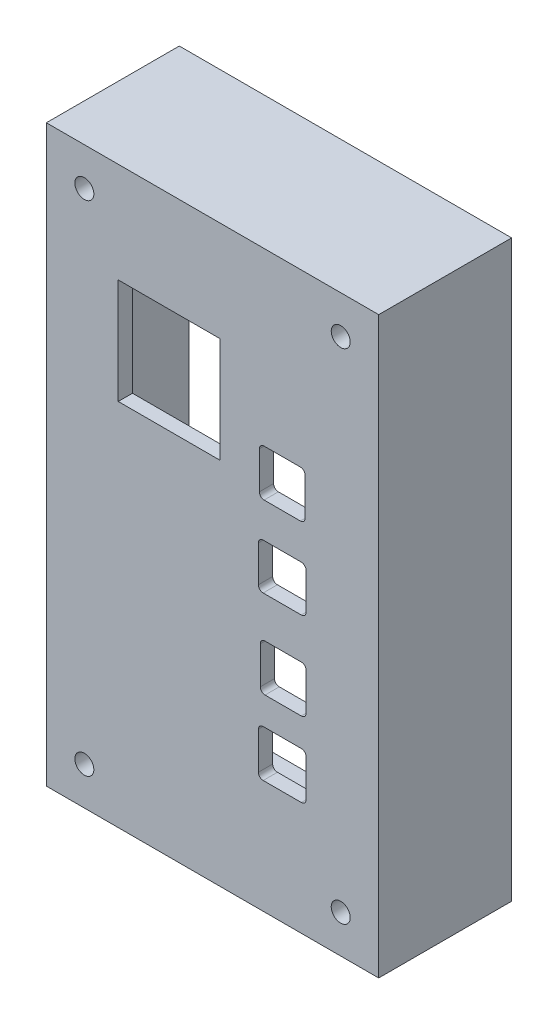
from build123d import *

# Parameters (mm, degrees)
SALIENTE_EXTRUIR1_OUTLINE_W   = 70
SALIENTE_EXTRUIR1_OUTLINE_H   = 121
SALIENTE_EXTRUIR1_OUTLINE_W_2 = 21.402751614
SALIENTE_EXTRUIR1_OUTLINE_H_2 = 22.176249264
SALIENTE_EXTRUIR1_DEPTH       = 3
CROQUIS3_W                    = 70
CROQUIS3_H                    = 121
CROQUIS3_W_2                  = 66
CROQUIS3_H_2                  = 117
SALIENTE_EXTRUIR2_DEPTH       = 25
CROQUIS6_R                    = 2
CORTAR_EXTRUIR1_DEPTH         = 10


# Read off the part's stored shape, not the designer's step: Saliente-Extruir1
with BuildPart() as part:
    # Saliente-Extruir1 outline → Saliente-Extruir1 (new body)
    with BuildSketch(Plane.XY):
        Rectangle(SALIENTE_EXTRUIR1_OUTLINE_W, SALIENTE_EXTRUIR1_OUTLINE_H)
        with BuildLine():
            Line((10.665295135, -26.794102385), (18.701771575, -26.794102385))
            ThreePointArc((18.701771575, -26.794102385), (19.408878356, -27.086995604), (19.701771575, -27.794102385))
            Line((19.701771575, -27.794102385), (19.701771575, -35.634526795))
            ThreePointArc((19.701771575, -35.634526795), (19.408878356, -36.341633576), (18.701771575, -36.634526795))
            Line((18.701771575, -36.634526795), (10.665295135, -36.634526795))
            ThreePointArc((10.665295135, -36.634526795), (9.958188354, -36.341633576), (9.665295135, -35.634526795))
            Line((9.665295135, -35.634526795), (9.665295135, -27.794102385))
            ThreePointArc((9.665295135, -27.794102385), (9.958188354, -27.086995604), (10.665295135, -26.794102385))
        make_face(mode=Mode.SUBTRACT)
        with BuildLine():
            Line((10.057242416, -19.858648736), (10.057242416, -12.018224326))
            ThreePointArc((10.057242416, -12.018224326), (10.350135635, -11.311117545), (11.057242416, -11.018224326))
            Line((11.057242416, -11.018224326), (18.701771575, -11.018224326))
            ThreePointArc((18.701771575, -11.018224326), (19.408878356, -11.311117545), (19.701771575, -12.018224326))
            Line((19.701771575, -12.018224326), (19.701771575, -19.858648736))
            ThreePointArc((19.701771575, -19.858648736), (19.408878356, -20.565755517), (18.701771575, -20.858648736))
            Line((18.701771575, -20.858648736), (11.057242416, -20.858648736))
            ThreePointArc((11.057242416, -20.858648736), (10.350135635, -20.565755517), (10.057242416, -19.858648736))
        make_face(mode=Mode.SUBTRACT)
        with Locations((-9.158031826, 28.317647119)):
            Rectangle(SALIENTE_EXTRUIR1_OUTLINE_W_2, SALIENTE_EXTRUIR1_OUTLINE_H_2, mode=Mode.SUBTRACT)
        with BuildLine():
            Line((9.665295135, -1.437126531), (9.665295135, 6.207324239))
            ThreePointArc((9.665295135, 6.207324239), (9.958188354, 6.91443102), (10.665295135, 7.207324239))
            Line((10.665295135, 7.207324239), (18.701771575, 7.207324239))
            ThreePointArc((18.701771575, 7.207324239), (19.408878356, 6.91443102), (19.701771575, 6.207324239))
            Line((19.701771575, 6.207324239), (19.701771575, -1.437126531))
            ThreePointArc((19.701771575, -1.437126531), (19.408878356, -2.144233312), (18.701771575, -2.437126531))
            Line((18.701771575, -2.437126531), (10.665295135, -2.437126531))
            ThreePointArc((10.665295135, -2.437126531), (9.958188354, -2.144233312), (9.665295135, -1.437126531))
        make_face(mode=Mode.SUBTRACT)
        with BuildLine():
            Line((9.861268776, 15.612580192), (9.861268776, 23.453004601))
            ThreePointArc((9.861268776, 23.453004601), (10.154161995, 24.160111382), (10.861268776, 24.453004601))
            Line((10.861268776, 24.453004601), (18.505797934, 24.453004601))
            ThreePointArc((18.505797934, 24.453004601), (19.212904715, 24.160111382), (19.505797934, 23.453004601))
            Line((19.505797934, 23.453004601), (19.505797934, 15.612580192))
            ThreePointArc((19.505797934, 15.612580192), (19.212904715, 14.905473411), (18.505797934, 14.612580192))
            Line((18.505797934, 14.612580192), (10.861268776, 14.612580192))
            ThreePointArc((10.861268776, 14.612580192), (10.154161994, 14.90547341), (9.861268776, 15.612580192))
        make_face(mode=Mode.SUBTRACT)
    extrude(amount=SALIENTE_EXTRUIR1_DEPTH)

    # Croquis3 → Saliente-Extruir2 (add)
    with BuildSketch(Plane(origin=(0, 0, 0), x_dir=(-1, 0, 0), z_dir=(0, 0, -1))):
        Rectangle(CROQUIS3_W, CROQUIS3_H)
        Rectangle(CROQUIS3_W_2, CROQUIS3_H_2, mode=Mode.SUBTRACT)
    extrude(amount=SALIENTE_EXTRUIR2_DEPTH)

    # Croquis6 → Cortar-Extruir1 (cut)
    with BuildSketch(Plane.XY.offset(3)):
        with Locations((-27, 52.5)):
            Circle(CROQUIS6_R)
        with Locations(Location((-27, -52.5, 0), (0, 0, 180))):
            Circle(CROQUIS6_R)
        with Locations((27, -52.5)):
            Circle(CROQUIS6_R)
        with Locations(Location((27, 52.5, 0), (0, 0, 180))):
            Circle(CROQUIS6_R)
    extrude(amount=-CORTAR_EXTRUIR1_DEPTH, mode=Mode.SUBTRACT)


solid = part.part
